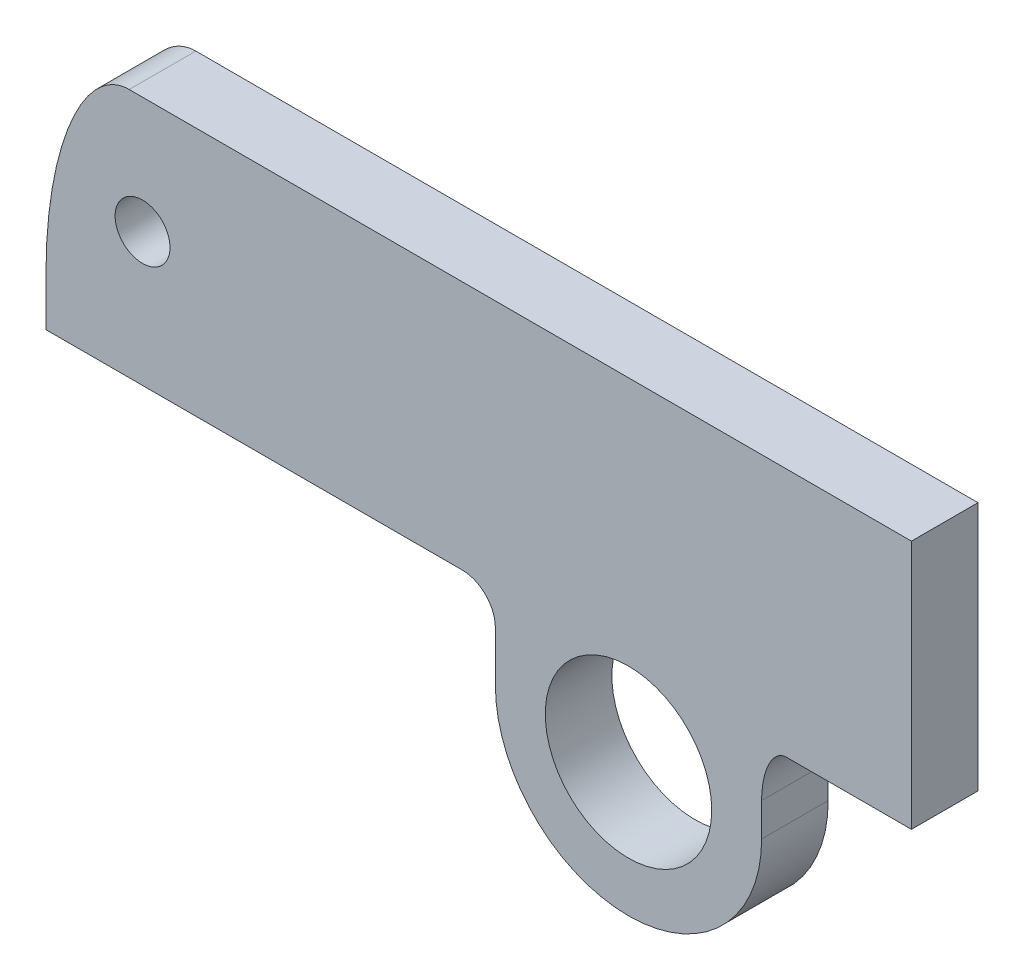
from build123d import *

# Parameters (mm, degrees)
RESSALTO_EXTRUS_O1_DEPTH = 4
FILETE3_R                = 8
ESBO_O2_R                = 1.65
ESBO_O2_R_2              = 5
CORTE_EXTRUS_O1_DEPTH    = 40.102429592
FILETE12_SIZE            = 5
FILETE12_SIZE_2          = 12
FILETE14_R               = 2
ESBO_O3_W                = 9
ESBO_O3_H                = 13
CORTE_EXTRUS_O2_DEPTH    = 40.102429743
FILETE15_R               = 8
FILETE16_SIZE            = 3
FILETE16_SIZE_2          = 1.5


# Some blends are built 0.0001 mm under size
with BuildPart() as part:
    # Esboço1 → Ressalto-extrusão1 (new body)
    with BuildSketch(Plane.XY):
        Polygon((0, 0), (25, 0), (25, 28), (-27, 28), (-27, 13), (0, 13), align=None)
    extrude(amount=RESSALTO_EXTRUS_O1_DEPTH)

    # Filete3
    filete3_edges = [part.edges().sort_by_distance(p)[0] for p in [
        (0, 0, 2),
    ]]
    fillet(filete3_edges, radius=FILETE3_R)

    # Esboço2 → Corte-extrusão1 (cut, through all)
    with BuildSketch(Plane.XY.offset(4)):
        with Locations((-21.2, 21)):
            Circle(ESBO_O2_R)
        with Locations((8, 8)):
            Circle(ESBO_O2_R_2)
    extrude(amount=-CORTE_EXTRUS_O1_DEPTH, mode=Mode.SUBTRACT)

    # Filete12
    # an asymmetric fillet: 12, 5 mm, written as the material it takes off along each edge
    with BuildSketch(Plane(origin=(-27, 28, -30), x_dir=(1, 0, 0), z_dir=(0, 0, 1))) as filete12_piece_1:
        with BuildLine():
            Bezier((FILETE12_SIZE, 0), (0, 0), (0, -FILETE12_SIZE_2), weights=[1, 0.707106781, 1])
            Line((0, -FILETE12_SIZE_2), (0, 0))
            Line((0, 0), (FILETE12_SIZE, 0))
        make_face()
    extrude(amount=64, mode=Mode.SUBTRACT)

    # Filete14
    filete14_edges = [part.edges().sort_by_distance(p)[0] for p in [
        (0, 13, 2),
    ]]
    fillet(filete14_edges, radius=FILETE14_R)

    # Esboço3 → Corte-extrusão2 (cut, through all)
    with BuildSketch(Plane.XY.offset(4)):
        with Locations((20.5, 6.5)):
            Rectangle(ESBO_O3_W, ESBO_O3_H)
    extrude(amount=-CORTE_EXTRUS_O2_DEPTH, mode=Mode.SUBTRACT)

    # Filete15
    filete15_edges = [part.edges().sort_by_distance(p)[0] for p in [
        (16, 0, 2),
    ]]
    fillet(filete15_edges, radius=FILETE15_R - 0.0001)  # a hair under: the kernel refuses the full size

    # Filete16
    # an asymmetric fillet: 3, 1.5 mm, written as the material it adds along each edge
    with BuildSketch(Plane(origin=(16, 13, 4), x_dir=(0, -1, 0), z_dir=(0, 0, -1))) as filete16_piece_1:
        with BuildLine():
            Bezier((FILETE16_SIZE, 0), (0, 0), (0, -FILETE16_SIZE_2), weights=[1, 0.707106781, 1])
            Line((0, -FILETE16_SIZE_2), (0, 0))
            Line((0, 0), (FILETE16_SIZE, 0))
        make_face()
    extrude(amount=4)


solid = part.part
